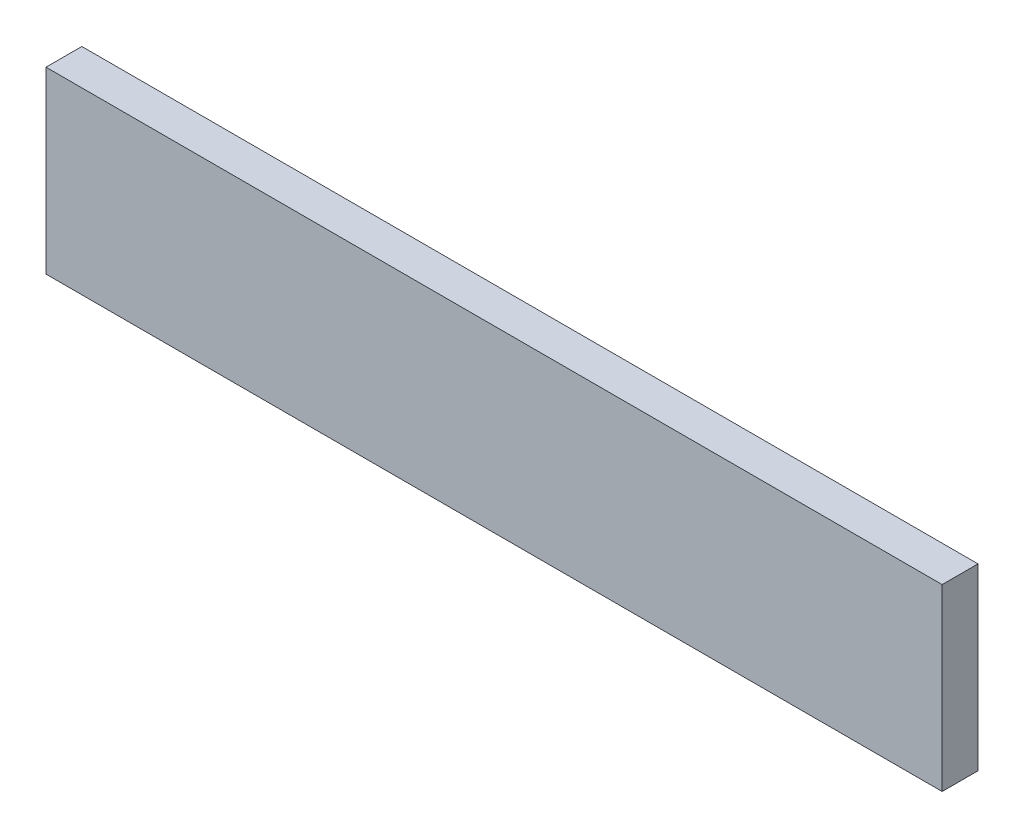
from build123d import *

# Parameters (mm, degrees)
SKETCH1_W           = 150
SKETCH1_H           = 30
BOSS_EXTRUDE1_DEPTH = 6


with BuildPart() as part:
    # Sketch1 → Boss-Extrude1 (new body)
    with BuildSketch(Plane.XY):
        with Locations((75, 15)):
            Rectangle(SKETCH1_W, SKETCH1_H)
    extrude(amount=BOSS_EXTRUDE1_DEPTH)


solid = part.part
